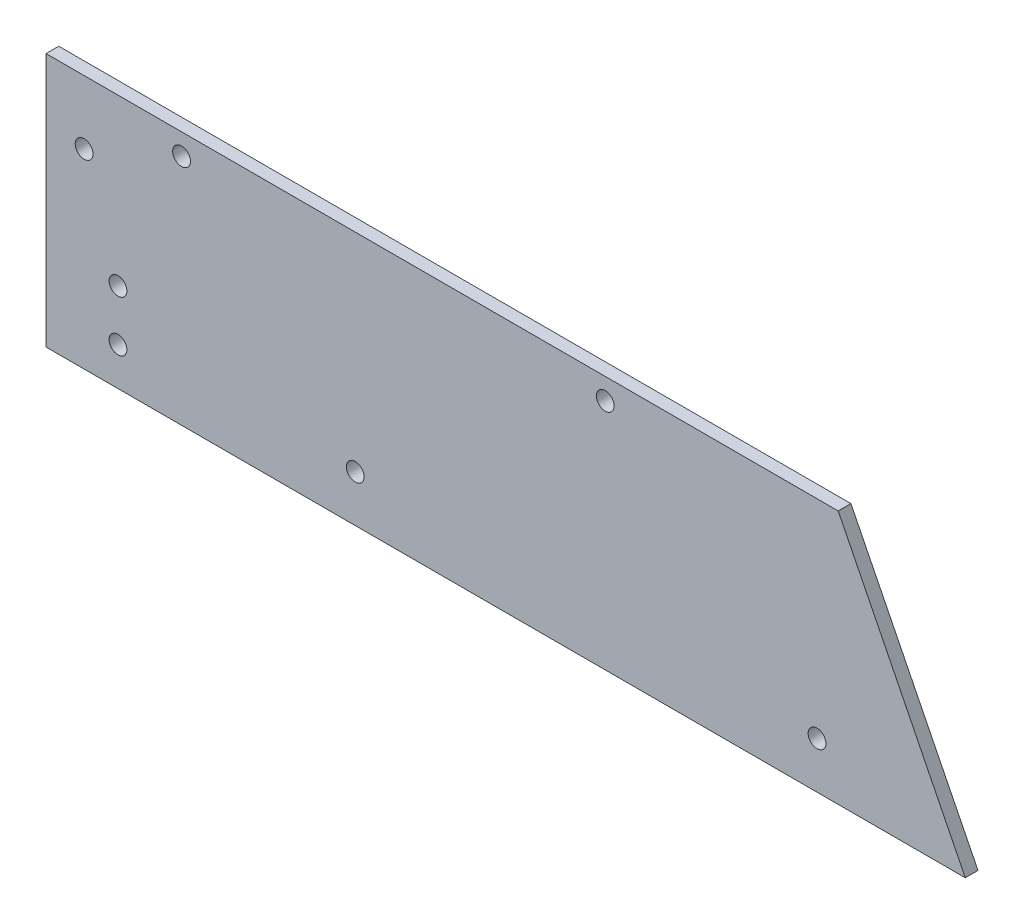
from build123d import *

# Parameters (mm, degrees)
SZKIC1_W                    = 217
SZKIC1_H                    = 60
DODANIE_WYCI_GNI_CIE1_DEPTH = 3
WYTNIJ_WYCI_GNI_CIE1_DEPTH  = 3
SZKIC3_R                    = 2.1
WYTNIJ_WYCI_GNI_CIE2_DEPTH  = 3
SZKIC4_R                    = 2.1
WYTNIJ_WYCI_GNI_CIE3_DEPTH  = 10
SZKIC5_R                    = 2.1
WYTNIJ_WYCI_GNI_CIE4_DEPTH  = 10
SZKIC6_R                    = 2.1
WYTNIJ_WYCI_GNI_CIE5_DEPTH  = 10


with BuildPart() as part:
    # Szkic1 → Dodanie-wyciągnięcie1 (new body)
    with BuildSketch(Plane.XY):
        with Locations((108.5, 30)):
            Rectangle(SZKIC1_W, SZKIC1_H)
    extrude(amount=DODANIE_WYCI_GNI_CIE1_DEPTH)

    # Szkic2 → Wytnij-wyciągnięcie1 (cut)
    with BuildSketch(Plane.XY.offset(3)):
        Polygon((187, 60), (217, 0), (217, 60), align=None)
    extrude(amount=-WYTNIJ_WYCI_GNI_CIE1_DEPTH, mode=Mode.SUBTRACT)

    # Szkic3 → Wytnij-wyciągnięcie2 (cut)
    with BuildSketch(Plane.XY.offset(3)):
        with Locations((17, 9)):
            Circle(SZKIC3_R)
        with Locations((17, 21)):
            Circle(SZKIC3_R)
    extrude(amount=-WYTNIJ_WYCI_GNI_CIE2_DEPTH, mode=Mode.SUBTRACT)

    # Szkic4 → Wytnij-wyciągnięcie3 (cut)
    with BuildSketch(Plane.XY.offset(3)):
        with Locations((73, 11)):
            Circle(SZKIC4_R)
        with Locations((182, 11)):
            Circle(SZKIC4_R)
    extrude(amount=-WYTNIJ_WYCI_GNI_CIE3_DEPTH, mode=Mode.SUBTRACT)

    # Szkic5 → Wytnij-wyciągnięcie4 (cut)
    with BuildSketch(Plane.XY.offset(3)):
        with Locations((32, 55)):
            Circle(SZKIC5_R)
        with Locations((132, 55)):
            Circle(SZKIC5_R)
    extrude(amount=-WYTNIJ_WYCI_GNI_CIE4_DEPTH, mode=Mode.SUBTRACT)

    # Szkic6 → Wytnij-wyciągnięcie5 (cut)
    with BuildSketch(Plane.XY.offset(3)):
        with Locations((9, 45)):
            Circle(SZKIC6_R)
    extrude(amount=-WYTNIJ_WYCI_GNI_CIE5_DEPTH, mode=Mode.SUBTRACT)


solid = part.part
